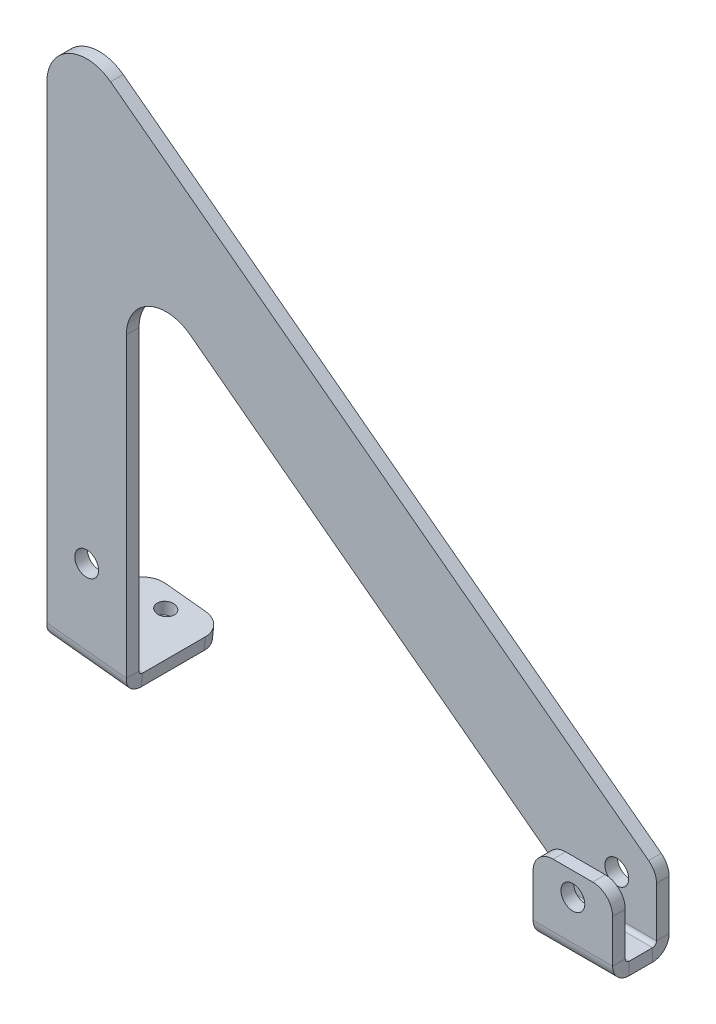
from build123d import *

# Parameters (mm, degrees)
BASE_FLANGE1_DEPTH           = 3.175
EDGE_FLANGE3_DEPTH           = 20
EDGE_FLANGE4_STRIP_W         = 14.7
EDGE_FLANGE4_STRIP_H         = 3.175
EDGE_FLANGE4_STRIP_CUT_DEPTH = 20
EDGE_FLANGE4_DEPTH           = 20
CUT_EXTRUDE1_DEPTH           = 194.888053308
CUT_EXTRUDE1_DEPTH_BACK      = 194.888053308
SKETCH12_R                   = 3
TAB1_DEPTH                   = 3.175
EDGE_FLANGE5_DEPTH           = 20.110165591
FILLET1_R                    = 10
FILLET2_R                    = 5
SKETCH27_R                   = 2.155423697
CUT_EXTRUDE2_DEPTH           = 196.8016212


# Sheet-metal steps are written as plain solids
with BuildPart() as part:
    # Sketch1 → Base-Flange1 (new body)
    with BuildSketch(Plane.XY):
        Polygon((10, 0), (10, 84.928918998), (123.372130178, -0.503108866), (143.372130178, -0.503108866), (143.372130178, 14.482707214), (-10, 130.056897083), (-10, 0), align=None)
    extrude(amount=-BASE_FLANGE1_DEPTH)

    # Edge-Flange3 section (across the edge) → Edge-Flange3 (add)
    with BuildSketch(Plane(origin=(123.372130178, -1.503108866, 0), x_dir=(0, 1, 0), z_dir=(1, 0, 0))):
        with BuildLine():
            Line((-3.175, 1), (-3.175, 11.055))
            Line((-3.175, 11.055), (0, 11.055))
            Line((0, 11.055), (0, 1))
            ThreePointArc((0, 1), (0.292893219, 0.292893219), (1, 0))
            Line((1, 0), (1, -3.175))
            ThreePointArc((1, -3.175), (-1.952170811, -1.952170811), (-3.175, 1))
        make_face()
    extrude(amount=EDGE_FLANGE3_DEPTH)

    # Edge-Flange4 strip (across the edge) → Edge-Flange4 strip cut (cut)
    with BuildSketch(Plane(origin=(123.372130178, -1.503108866, 11.055), x_dir=(0, 0, -1), z_dir=(1, 0, 0))):
        with Locations((-3.175, -1.5875)):
            Rectangle(EDGE_FLANGE4_STRIP_W, EDGE_FLANGE4_STRIP_H)
    extrude(amount=EDGE_FLANGE4_STRIP_CUT_DEPTH, mode=Mode.SUBTRACT)

    # Edge-Flange4 section (across the edge) → Edge-Flange4 (add)
    with BuildSketch(Plane(origin=(123.372130178, -1.503108866, 11.055), x_dir=(0, 0, -1), z_dir=(1, 0, 0))):
        with BuildLine():
            Line((0, 1), (0, 16.825))
            Line((0, 16.825), (3.175, 16.825))
            Line((3.175, 16.825), (3.175, 1))
            ThreePointArc((3.175, 1), (3.467893219, 0.292893219), (4.175, 0))
            Line((4.175, 0), (4.175, -3.175))
            ThreePointArc((4.175, -3.175), (1.222829189, -1.952170811), (0, 1))
        make_face()
    extrude(amount=EDGE_FLANGE4_DEPTH)

    # Sketch12 → Cut-Extrude1 (cut, two sides: drawn at the far end of the back side and taken through both)
    with BuildSketch(Plane.XY.offset(-CUT_EXTRUDE1_DEPTH_BACK)):
        with Locations(Location((133.372130178, 9.496891134, 0), (0, 0, 180))):
            Circle(SKETCH12_R)
        with Locations((0, 10)):
            Circle(SKETCH12_R)
    extrude(amount=CUT_EXTRUDE1_DEPTH + CUT_EXTRUDE1_DEPTH_BACK, mode=Mode.SUBTRACT)

    # Sketch19 → Tab1 (add)
    with BuildSketch(Plane.XY):
        Polygon((-10, 0), (10, 0), (10, -10), (-10, -7.897915295), align=None)
    extrude(amount=-TAB1_DEPTH)

    # Edge-Flange5 section (across the edge) → Edge-Flange5 (add)
    with BuildSketch(Plane(origin=(9.895471537, -10.994521895, -3.175), x_dir=(0.10452846326765029, 0.9945218953682737, -3.4914813388431334e-15), z_dir=(-0.9945218953682737, 0.10452846326765029, 0))):
        with BuildLine():
            Line((-3.175, 1), (-3.175, 21.825))
            Line((-3.175, 21.825), (0, 21.825))
            Line((0, 21.825), (0, 1))
            ThreePointArc((0, 1), (0.292893219, 0.292893219), (1, 0))
            Line((1, 0), (1, -3.175))
            ThreePointArc((1, -3.175), (-1.952170811, -1.952170811), (-3.175, 1))
        make_face()
    extrude(amount=EDGE_FLANGE5_DEPTH)

    # Fillet1
    fillet1_edges = [part.edges().sort_by_distance(p)[0] for p in [
        (-10, 130.056897083, -1.5875),
        (10, 84.928918998, -1.5875),
    ]]
    fillet(fillet1_edges, radius=FILLET1_R)

    # Fillet2
    fillet2_edges = [part.edges().sort_by_distance(p)[0] for p in [
        (9.729532601, -12.573325404, -25),
        (-10.270467399, -10.471240699, -25),
        (143.372130178, 14.482707214, -1.5875),
        (123.372130178, 15.321891134, 9.4675),
        (143.372130178, 15.321891134, 9.4675),
    ]]
    fillet(fillet2_edges, radius=FILLET2_R)

    # Sketch27 → Cut-Extrude2 (cut, through all)
    with BuildSketch(Plane(origin=(-1.034824921, -9.845701445, 0), x_dir=(0.9945218953682736, -0.10452846326765024, 0), z_dir=(0.10452846326765025, 0.9945218953682737, -3.503032532656101e-15))):
        with Locations(Location((0.935420791, 20, 0), (0, 0, 180))):
            Circle(SKETCH27_R)
        with Locations(Location((0.935420791, 10, 0), (0, 0, 180))):
            Circle(SKETCH27_R)
    extrude(amount=-CUT_EXTRUDE2_DEPTH, mode=Mode.SUBTRACT)


solid = part.part
